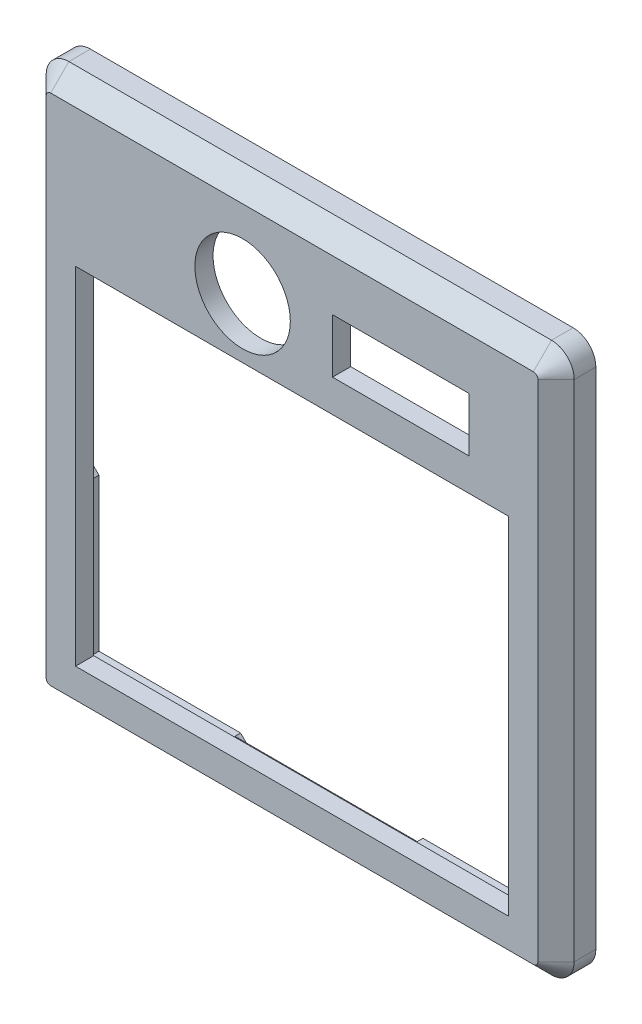
from build123d import *

# Parameters (mm, degrees)
SKETCH1_W                                  = 120.9294
SKETCH1_H                                  = 116.1796
SKETCH1_R                                  = 10.5
SKETCH1_W_2                                = 11.906
SKETCH1_H_2                                = 30.0122
SKETCH1_W_3                                = 76.19975
SKETCH1_H_3                                = 95.2627
BOSS_EXTRUDE1_DEPTH                        = 4
SKETCH2_W                                  = 116.1796
SKETCH2_H                                  = 120.9294
SKETCH2_W_2                                = 102.459137156
SKETCH2_H_2                                = 106.648
BOSS_EXTRUDE2_DEPTH                        = 4.75
CUT_EXTRUDE1_DEPTH                         = 1.25
SKETCH6_W                                  = 25.4
SKETCH6_H                                  = 2.0635
SKETCH6_W_2                                = 1.783031422
SKETCH6_H_2                                = 25.4
CUT_EXTRUDE2_DEPTH                         = 2
CUT_EXTRUDE3_DEPTH                         = 10.16
SKETCH8_R                                  = 1.3
CUT_EXTRUDE4_DEPTH                         = 4
MIRROR1_AT_THE_SECOND_PLANE_COPY_1_SKETC_R = 1.3
MIRROR1_AT_THE_SECOND_PLANE_COPY_1_DEPTH   = 4
FILLET1_R                                  = 5
CHAMFER1_SIZE                              = 4


with BuildPart() as part:
    # Sketch1 → Boss-Extrude1 (new body)
    with BuildSketch(Plane(origin=(0, 0, 0), x_dir=(0, 1, 0), z_dir=(0, 0, 1))):
        Rectangle(SKETCH1_W, SKETCH1_H)
        with Locations(Location((39.3375, 10.8746, 0), (0, 0, 270))):
            Circle(SKETCH1_R, mode=Mode.SUBTRACT)
        with Locations((39.2905, -23.9125)):
            Rectangle(SKETCH1_W_2, SKETCH1_H_2, mode=Mode.SUBTRACT)
        with Locations((-11.906375, 0)):
            Rectangle(SKETCH1_W_3, SKETCH1_H_3, mode=Mode.SUBTRACT)
    extrude(amount=BOSS_EXTRUDE1_DEPTH)

    # Sketch2 → Boss-Extrude2 (add)
    with BuildSketch(Plane(origin=(0, 0, 0), x_dir=(-1, 0, 0), z_dir=(0, 0, -1))):
        Rectangle(SKETCH2_W, SKETCH2_H)
        Rectangle(SKETCH2_W_2, SKETCH2_H_2, mode=Mode.SUBTRACT)
    extrude(amount=BOSS_EXTRUDE2_DEPTH)

    # Sketch4 → Cut-Extrude1 (cut)
    with BuildSketch(Plane(origin=(0, 0, -4.75), x_dir=(-1, 0, 0), z_dir=(0, 0, -1))):
        Polygon((-50.0126, -52.3875), (-21, -52.3875), (-16, -57.3875), (16, -57.3875), (21, -52.3875), (50.0126, -52.3875), (50.0126, -21), (55.0126, -16), (55.0126, 16), (50.0126, 21), (50.0126, 52.3875), (21, 52.3875), (16, 57.3875), (-16, 57.3875), (-21, 52.3875), (-50.0126, 52.3875), (-50.0126, 21), (-55.0126, 16), (-55.0126, -16), (-50.0126, -21), align=None)
    extrude(amount=-CUT_EXTRUDE1_DEPTH, mode=Mode.SUBTRACT)

    # Sketch6 → Cut-Extrude2 (cut)
    with BuildSketch(Plane(origin=(0, 0, -3.5), x_dir=(1, 0, 0), z_dir=(0, 0, -1))):
        with Locations((0, 55.35575)):
            Rectangle(SKETCH6_W, SKETCH6_H)
        with Locations((0, -55.35575)):
            Rectangle(SKETCH6_W, SKETCH6_H)
        with Locations((-53.121084289, 0)):
            Rectangle(SKETCH6_W_2, SKETCH6_H_2)
        with Locations((53.121084289, 0)):
            Rectangle(SKETCH6_W_2, SKETCH6_H_2)
    extrude(amount=-CUT_EXTRUDE2_DEPTH, mode=Mode.SUBTRACT)

    # Sketch7 → Cut-Extrude3 (cut)
    with BuildSketch(Plane(origin=(-58.0898, 0, 0), x_dir=(0, -1, 0), z_dir=(-1, 0, 0))):
        with BuildLine():
            Line((-44.8211, 1.2342), (-34.9603, 1.2342))
            ThreePointArc((-34.9603, 1.2342), (-33.164248776, 0.490251224), (-32.4203, -1.3058))
            Line((-32.4203, -1.3058), (-32.4203, -5.3754))
            ThreePointArc((-32.4203, -5.3754), (-33.164248776, -7.171451224), (-34.9603, -7.9154))
            Line((-34.9603, -7.9154), (-44.8211, -7.9154))
            ThreePointArc((-44.8211, -7.9154), (-46.617151224, -7.171451224), (-47.3611, -5.3754))
            Line((-47.3611, -5.3754), (-47.3611, -1.3058))
            ThreePointArc((-47.3611, -1.3058), (-46.617151224, 0.490251224), (-44.8211, 1.2342))
        make_face()
    extrude(amount=-CUT_EXTRUDE3_DEPTH, mode=Mode.SUBTRACT)

    # Sketch8 → Cut-Extrude4 (cut)
    with BuildSketch(Plane(origin=(0, 0, -4.75), x_dir=(1, 0, 0), z_dir=(0, 0, -1))):
        with Locations(Location((-54.0258, 56.4007, 0), (0, 0, 180))):
            Circle(SKETCH8_R)
    cut_extrude4 = extrude(amount=-CUT_EXTRUDE4_DEPTH, mode=Mode.SUBTRACT)

    # Mirror1: Cut-Extrude4 across plane
    add(cut_extrude4.mirror(Plane(origin=(0, 0, 0), x_dir=(0, 0, 1), z_dir=(1, 0, 0))), mode=Mode.SUBTRACT)

    # Mirror1 at the second plane: Cut-Extrude4 across plane
    add(cut_extrude4.mirror(Plane.ZX), mode=Mode.SUBTRACT)

    # Mirror1 at the second plane copy 1 sketc → Mirror1 at the second plane copy 1 (cut)
    with BuildSketch(Plane(origin=(0, 0, -4.75), x_dir=(-1, 0, 0), z_dir=(0, 0, -1))):
        with Locations(Location((-54.0258, 56.4007, 0), (0, 0, 180))):
            Circle(MIRROR1_AT_THE_SECOND_PLANE_COPY_1_SKETC_R)
    extrude(amount=-MIRROR1_AT_THE_SECOND_PLANE_COPY_1_DEPTH, mode=Mode.SUBTRACT)

    # Fillet1
    fillet1_edges = [part.edges().sort_by_distance(p)[0] for p in [
        (58.0898, 60.4647, -0.375),
        (58.0898, -60.4647, -0.375),
        (-58.0898, -60.4647, -0.375),
        (-58.0898, 60.4647, -0.375),
    ]]
    fillet(fillet1_edges, radius=FILLET1_R)

    # Chamfer1
    # the kernel refuses this chamfer: 4 mm, written as the material it takes off along each edge
    with BuildSketch(Plane(origin=(-53.0898, -60.4647, 4), x_dir=(0, 0.9996219169112968, 0.027495876610586296), z_dir=(1, 0, 0)), Plane(origin=(53.0898, 60.4647, 4), x_dir=(0, -0.9996219169112968, 0.027495876610586296), z_dir=(-1, 0, 0))) as chamfer1_piece_1:
        Polygon((CHAMFER1_SIZE * 0.999621916911, -CHAMFER1_SIZE * 0.0274958766106), (-CHAMFER1_SIZE * 0.0274958766106, -CHAMFER1_SIZE * 0.999621916911), (0, 0), align=None)
    extrude(amount=106.1796, mode=Mode.SUBTRACT)
    with BuildSketch(Plane(origin=(58.0898, -55.4647, 4), x_dir=(0.02749587661058563, 0, -0.9996219169112968), z_dir=(0, 1, 0))) as chamfer1_piece_2:
        Polygon((CHAMFER1_SIZE * 0.999621916911, CHAMFER1_SIZE * 0.0274958766106), (-CHAMFER1_SIZE * 0.0274958766106, CHAMFER1_SIZE * 0.999621916911), (0, 0), align=None)
    extrude(amount=110.9294, mode=Mode.SUBTRACT)
    with BuildSketch(Plane(origin=(-58.0898, 55.4647, 4), x_dir=(0.9996219169112968, 0, 0.027495876610586296), z_dir=(0, -1, 0))) as chamfer1_piece_3:
        Polygon((CHAMFER1_SIZE * 0.999621916911, -CHAMFER1_SIZE * 0.0274958766106), (-CHAMFER1_SIZE * 0.0274958766106, -CHAMFER1_SIZE * 0.999621916911), (0, 0), align=None)
    extrude(amount=110.9294, mode=Mode.SUBTRACT)
    with BuildSketch(Plane(origin=(53.0898, 55.4647, 4), x_dir=(1, 0, 0), z_dir=(0, -1, 0))) as chamfer1_piece_4:
        Polygon((5 - CHAMFER1_SIZE, 0), (5, -CHAMFER1_SIZE), (5, 0), align=None)
    revolve(axis=Axis((53.0898, 55.4647, 4), (0, 0, 1)), revolution_arc=90, mode=Mode.SUBTRACT)
    with BuildSketch(Plane(origin=(53.0898, -55.4647, 4), x_dir=(1, 0, 0), z_dir=(0, 1, 0))) as chamfer1_piece_5:
        Polygon((5 - CHAMFER1_SIZE, 0), (5, CHAMFER1_SIZE), (5, 0), align=None)
    revolve(axis=Axis((53.0898, -55.4647, 4), (0, 0, -1)), revolution_arc=90, mode=Mode.SUBTRACT)
    with BuildSketch(Plane(origin=(-53.0898, 55.4647, 4), x_dir=(0, 1, 0), z_dir=(1, 0, 0))) as chamfer1_piece_6:
        Polygon((5 - CHAMFER1_SIZE, 0), (5, -CHAMFER1_SIZE), (5, 0), align=None)
    revolve(axis=Axis((-53.0898, 55.4647, 4), (0, 0, 1)), revolution_arc=90, mode=Mode.SUBTRACT)
    with BuildSketch(Plane(origin=(-53.0898, -55.4647, 4), x_dir=(0, -1, 0), z_dir=(1, 0, 0))) as chamfer1_piece_7:
        Polygon((5 - CHAMFER1_SIZE, 0), (5, CHAMFER1_SIZE), (5, 0), align=None)
    revolve(axis=Axis((-53.0898, -55.4647, 4), (0, 0, -1)), revolution_arc=90, mode=Mode.SUBTRACT)


solid = part.part
